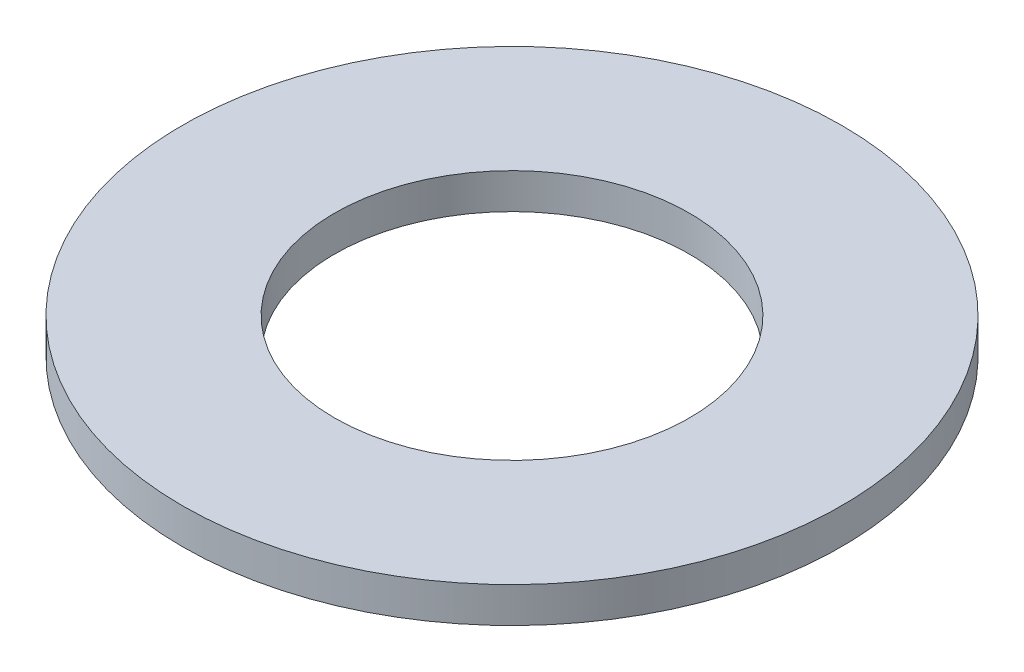
from build123d import *

# Parameters (mm, degrees)
SKETCH1_R           = 65
BOSS_EXTRUDE1_DEPTH = 7
SKETCH2_R           = 35
CUT_EXTRUDE1_DEPTH  = 93.190021152


with BuildPart() as part:
    # Sketch1 → Boss-Extrude1 (new body)
    with BuildSketch(Plane(origin=(0, 0, 0), x_dir=(1, 0, 0), z_dir=(0, 1, 0))):
        Circle(SKETCH1_R)
    extrude(amount=BOSS_EXTRUDE1_DEPTH)

    # Sketch2 → Cut-Extrude1 (cut, through all)
    with BuildSketch(Plane(origin=(0, 0, 0), x_dir=(1, 0, 0), z_dir=(0, 1, 0))):
        Circle(SKETCH2_R)
    extrude(amount=CUT_EXTRUDE1_DEPTH, mode=Mode.SUBTRACT)


solid = part.part
